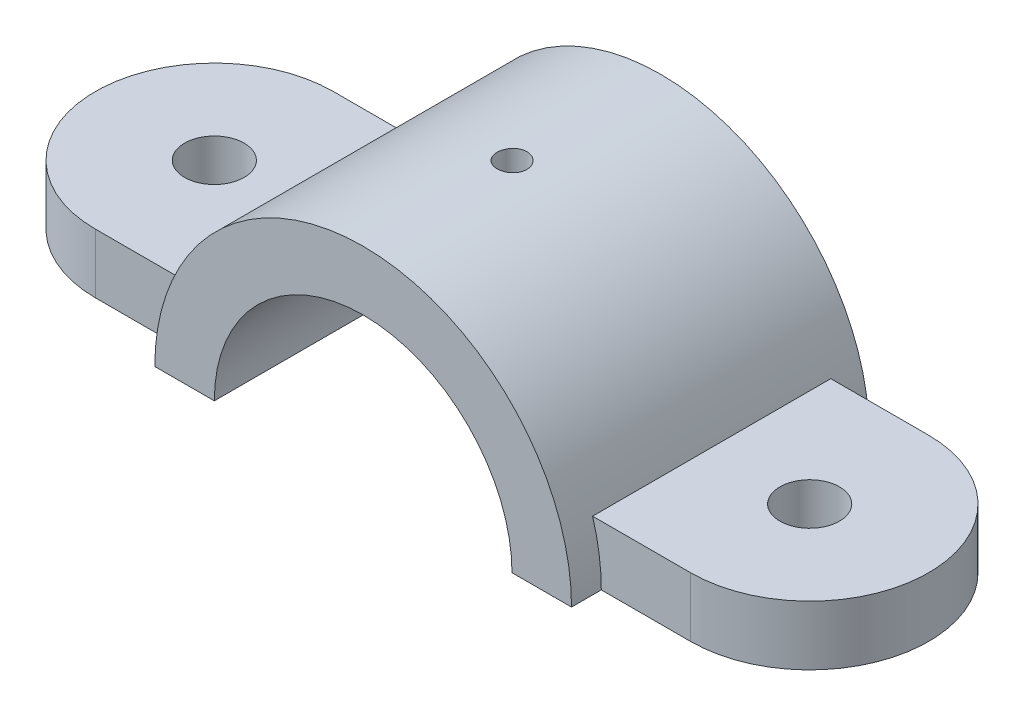
from build123d import *

# Parameters (mm, degrees)
SLOTSKETCH_R      = 6.35
SLOTEXTRUDE_DEPTH = 12.7
ARCEXTRUDE_DEPTH  = 31.75
CENTERDRILL_D     = 6.35
ARCPROFILE_DEPTH  = 118.946015285


with BuildPart() as part:
    # slotSketch → slotExtrude (new body)
    with BuildSketch(Plane(origin=(0, 0, 0), x_dir=(1, 0, 0), z_dir=(0, 1, 0))):
        with BuildLine():
            Line((-63.5, 25.4), (63.5, 25.4))
            ThreePointArc((63.5, 25.4), (88.9, 0), (63.5, -25.4))
            Line((63.5, -25.4), (-63.5, -25.4))
            ThreePointArc((-63.5, -25.4), (-88.9, 0), (-63.5, 25.4))
        make_face()
        with Locations((63.5, 0)):
            Circle(SLOTSKETCH_R, mode=Mode.SUBTRACT)
        with Locations((-63.5, 0)):
            Circle(SLOTSKETCH_R, mode=Mode.SUBTRACT)
    extrude(amount=SLOTEXTRUDE_DEPTH)

    # Sketch3 → arcExtrude (add, symmetric)
    with BuildSketch(Plane.XY):
        with BuildLine():
            Line((-44.45, 0), (44.45, 0))
            ThreePointArc((44.45, 0), (0, 44.45), (-44.45, 0))
        make_face()
    extrude(amount=ARCEXTRUDE_DEPTH, both=True)

    # centerDrill (through all)
    with Locations(Plane(origin=(0, 0, 0), x_dir=(-1, 0, 0), z_dir=(0, -1, 0))):
        with Locations((0, 0)):
            Hole(CENTERDRILL_D / 2)

    # Sketch7 → arcProfile (cut, through all)
    with BuildSketch(Plane.XY.offset(31.75)):
        with BuildLine():
            Line((-31.75, 0), (31.75, 0))
            ThreePointArc((31.75, 0), (0, 31.75), (-31.75, 0))
        make_face()
    extrude(amount=-ARCPROFILE_DEPTH, mode=Mode.SUBTRACT)


solid = part.part
